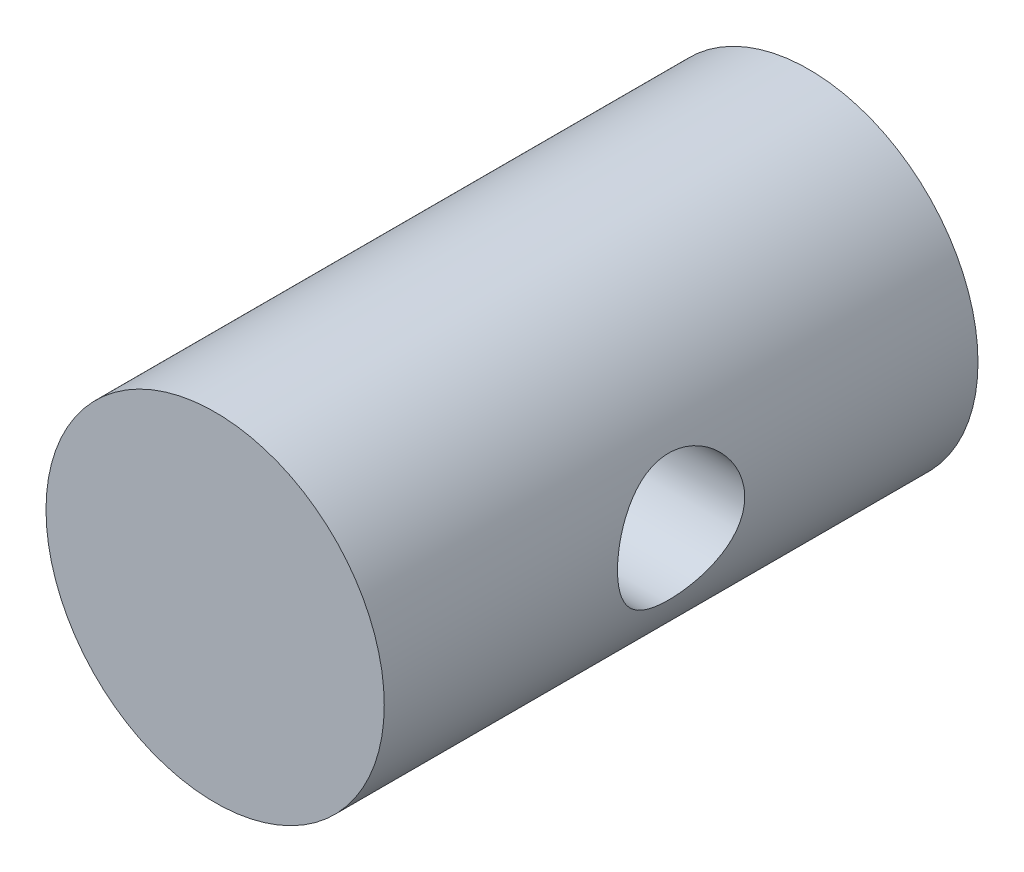
from build123d import *

# Parameters (mm, degrees)
SKETCH1_R               = 12.6619
BOSS_EXTRUDE1_DEPTH     = 44.45
CUT_EXTRUDE1_DEPTH      = 48.921288831
CUT_EXTRUDE1_DEPTH_BACK = 48.921288831
SKETCH2_R               = 4.7625


with BuildPart() as part:
    # Sketch1 → Boss-Extrude1 (new body)
    with BuildSketch(Plane(origin=(0, 0, 0), x_dir=(0, 1, 0), z_dir=(0, 0, 1))):
        Circle(SKETCH1_R)
    extrude(amount=BOSS_EXTRUDE1_DEPTH)

    # Sketch2 → Cut-Extrude1 (cut, two sides: drawn at the far end of the back side and taken through both)
    with BuildSketch(Plane.YZ.offset(-CUT_EXTRUDE1_DEPTH_BACK)):
        with Locations((0, 22.225)):
            Circle(SKETCH2_R)
    extrude(amount=CUT_EXTRUDE1_DEPTH + CUT_EXTRUDE1_DEPTH_BACK, mode=Mode.SUBTRACT)


solid = part.part
